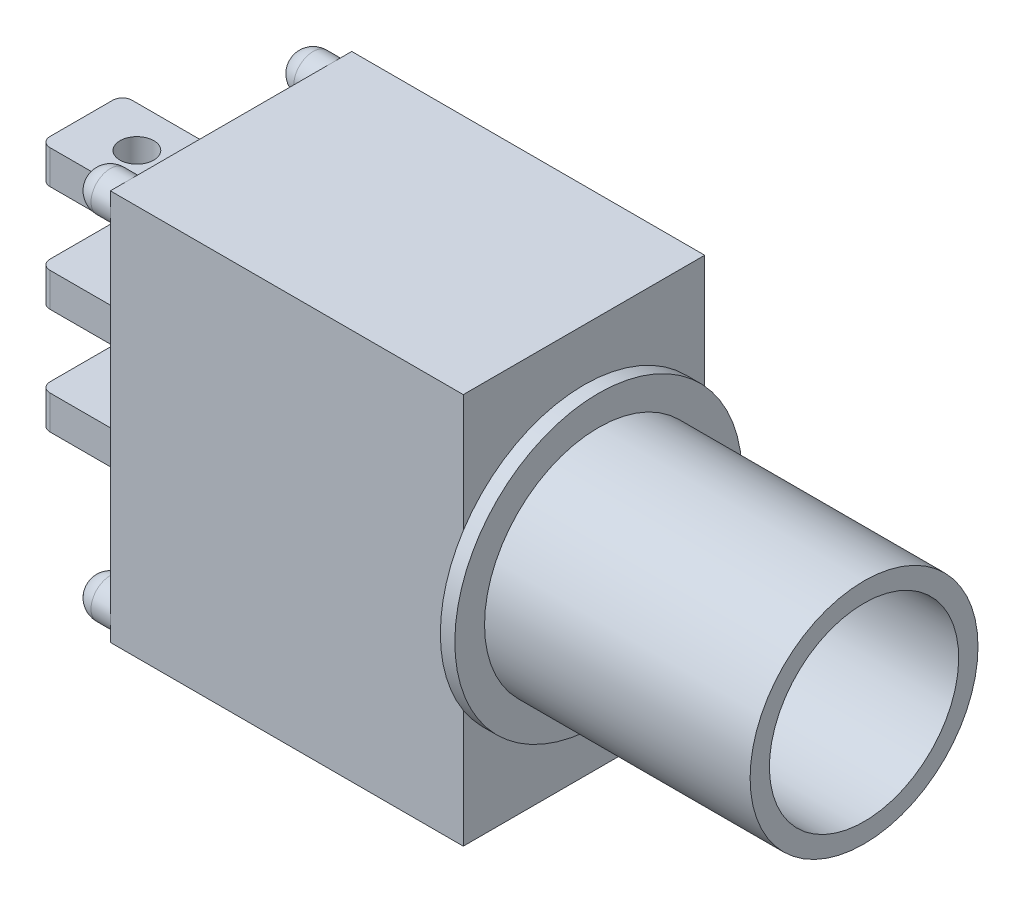
from build123d import *

# Parameters (mm, degrees)
BOSS_EXTRUDE1_DEPTH      = 2.5
BOSS_EXTRUDE1_DEPTH_BACK = 2.5
SKETCH1_W                = 7.31
SKETCH1_H                = 8.1
SKETCH2_R                = 0.4
BOSS_EXTRUDE2_DEPTH      = 0.8
FILLET1_R                = 0.4
SKETCH3_R                = 0.35
BOSS_EXTRUDE3_DEPTH      = 0.35
LPATTERN1_COUNT          = 2
LPATTERN1_PITCH          = 2.2
LPATTERN2_COUNT          = 2
LPATTERN2_PITCH          = 2.2
FILLET2_R                = 0.2
SKETCH4_R                = 2.975
BOSS_EXTRUDE4_DEPTH      = 0.3
SKETCH5_R                = 2.36
BOSS_EXTRUDE5_DEPTH      = 5.5
SHELL1_START             = -3.255
SHELL1_OUTLINE_W         = 7.3
SHELL1_OUTLINE_H         = 4.2
SHELL1_DEPTH             = 6.51
SHELL1_START_2           = 3.255
SHELL1_2_OUTLINE_R       = 1.96
SHELL1_2_DEPTH           = 6.2
SHELL1_3_OUTLINE_R       = 1.96
SHELL1_3_DEPTH           = 0.3


# Read off the part's stored shape, not the designer's step: Shell1
with BuildPart() as part:
    # Sketch1 → Boss-Extrude1 (new, two sides: drawn at the far end of the back side and taken through both)
    with BuildSketch(Plane.XY.offset(-BOSS_EXTRUDE1_DEPTH_BACK)):
        Rectangle(SKETCH1_W, SKETCH1_H)
    extrude(amount=BOSS_EXTRUDE1_DEPTH + BOSS_EXTRUDE1_DEPTH_BACK)

    # Sketch2 → Boss-Extrude2 (add)
    with BuildSketch(Plane.ZY.offset(3.655)):
        with Locations(Location((2.1, 3.65, 0), (0, 0, 90))):
            Circle(SKETCH2_R)
        with Locations(Location((2.1, -3.65, 0), (0, 0, 90))):
            Circle(SKETCH2_R)
        with Locations(Location((-2.1, -3.65, 0), (0, 0, 270))):
            Circle(SKETCH2_R)
        with Locations(Location((-2.1, 3.65, 0), (0, 0, 90))):
            Circle(SKETCH2_R)
    extrude(amount=BOSS_EXTRUDE2_DEPTH)

    # Fillet1
    fillet1_edges = [part.edges().sort_by_distance(p)[0] for p in [
        (-4.455, 3.25, 2.1),
        (-4.455, -4.05, 2.1),
        (-4.455, -3.25, -2.1),
        (-4.455, 3.25, -2.1),
    ]]
    fillet(fillet1_edges, radius=FILLET1_R)

    # Sketch3 → Boss-Extrude3 (add, symmetric)
    with BuildSketch(Plane(origin=(0, 0, 0), x_dir=(1, 0, 0), z_dir=(0, 1, 0))):
        Polygon((-3.655, 1.55), (-4.455, 1.55), (-4.455, 0.85), (-6.755, 0.85), (-6.755, -0.85), (-4.455, -0.85), (-4.455, -1.55), (-3.655, -1.55), align=None)
        with Locations(Location((-5.605, 0, 0), (0, 0, 270))):
            Circle(SKETCH3_R, mode=Mode.SUBTRACT)
    boss_extrude3 = extrude(amount=BOSS_EXTRUDE3_DEPTH, both=True)

    # LPattern1: Boss-Extrude3 ×2
    with Locations(*[(0, -i * LPATTERN1_PITCH, 0) for i in range(1, LPATTERN1_COUNT)]):
        add(boss_extrude3)

    # LPattern2: Boss-Extrude3 ×2
    with Locations(*[(0, i * LPATTERN2_PITCH, 0) for i in range(1, LPATTERN2_COUNT)]):
        add(boss_extrude3)

    # Fillet2
    fillet2_edges = [part.edges().sort_by_distance(p)[0] for p in [
        (-6.755, 2.2, -0.85),
        (-4.455, 2.2, -0.85),
        (-4.455, 2.2, -1.55),
        (-4.455, 2.2, 1.55),
        (-4.455, 2.2, 0.85),
        (-6.755, 2.2, 0.85),
        (-6.755, 0, -0.85),
        (-4.455, 0, -0.85),
        (-4.455, 0, -1.55),
        (-4.455, 0, 1.55),
        (-4.455, 0, 0.85),
        (-6.755, 0, 0.85),
        (-6.755, -2.2, -0.85),
        (-4.455, -2.2, -0.85),
        (-4.455, -2.2, -1.55),
        (-4.455, -2.2, 1.55),
        (-4.455, -2.2, 0.85),
        (-6.755, -2.2, 0.85),
    ]]
    fillet(fillet2_edges, radius=FILLET2_R)

    # Sketch4 → Boss-Extrude4 (add)
    with BuildSketch(Plane(origin=(3.655, 0, 0), x_dir=(0, 0, -1), z_dir=(1, 0, 0))):
        with Locations(Location((0, 0, 0), (0, 0, 212.824368373))):
            Circle(SKETCH4_R)
    extrude(amount=BOSS_EXTRUDE4_DEPTH)

    # Sketch5 → Boss-Extrude5 (add)
    with BuildSketch(Plane(origin=(3.955, 0, 0), x_dir=(0, 0, -1), z_dir=(1, 0, 0))):
        with Locations(Location((0, 0, 0), (0, 0, 90))):
            Circle(SKETCH5_R)
    extrude(amount=BOSS_EXTRUDE5_DEPTH)

    # Shell1 outline → Shell1 (cut)
    with BuildSketch(Plane.YZ.offset(SHELL1_START)):
        Rectangle(SHELL1_OUTLINE_W, SHELL1_OUTLINE_H)
    extrude(amount=SHELL1_DEPTH, mode=Mode.SUBTRACT)

    # Shell1 2 outline → Shell1 2 (cut)
    with BuildSketch(Plane.YZ.offset(SHELL1_START_2)):
        Circle(SHELL1_2_OUTLINE_R)
    extrude(amount=SHELL1_2_DEPTH, mode=Mode.SUBTRACT)

    # Shell1 3 outline → Shell1 3 (cut)
    with BuildSketch(Plane.YZ.offset(SHELL1_START_2)):
        with BuildLine():
            ThreePointArc((-1.490176164, 2.1), (-2.575, 0), (-1.490176164, -2.1))
            Line((-1.490176164, -2.1), (1.490176164, -2.1))
            ThreePointArc((1.490176164, -2.1), (2.575, 0), (1.490176164, 2.1))
            Line((1.490176164, 2.1), (-1.490176164, 2.1))
        make_face()
        Circle(SHELL1_3_OUTLINE_R, mode=Mode.SUBTRACT)
    extrude(amount=SHELL1_3_DEPTH, mode=Mode.SUBTRACT)


solid = part.part
